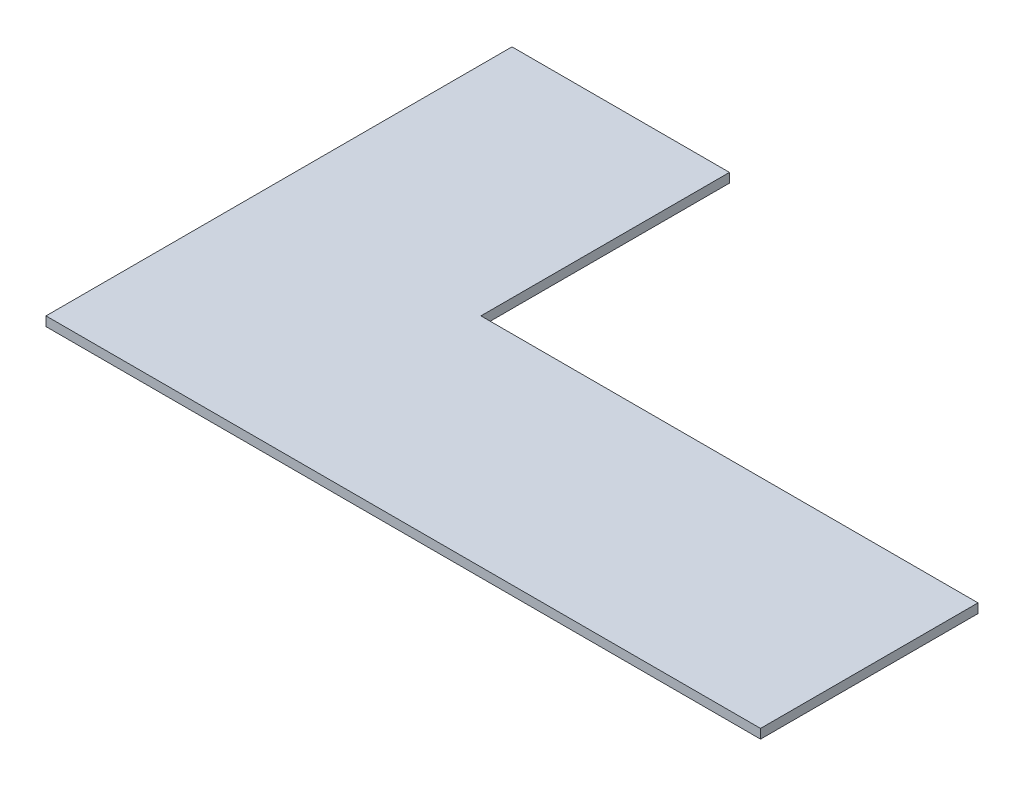
from build123d import *

# Parameters (mm, degrees)
BOSS_EXTRUDE1_DEPTH = 3


with BuildPart() as part:
    # Sketch1 → Boss-Extrude1 (new body)
    with BuildSketch(Plane(origin=(0, 0, 0), x_dir=(1, 0, 0), z_dir=(0, 1, 0))):
        Polygon((-115, -35), (115, -35), (115, 35), (-45, 35), (-45, 115), (-115, 115), (-115, 35), align=None)
    extrude(amount=BOSS_EXTRUDE1_DEPTH)


solid = part.part
